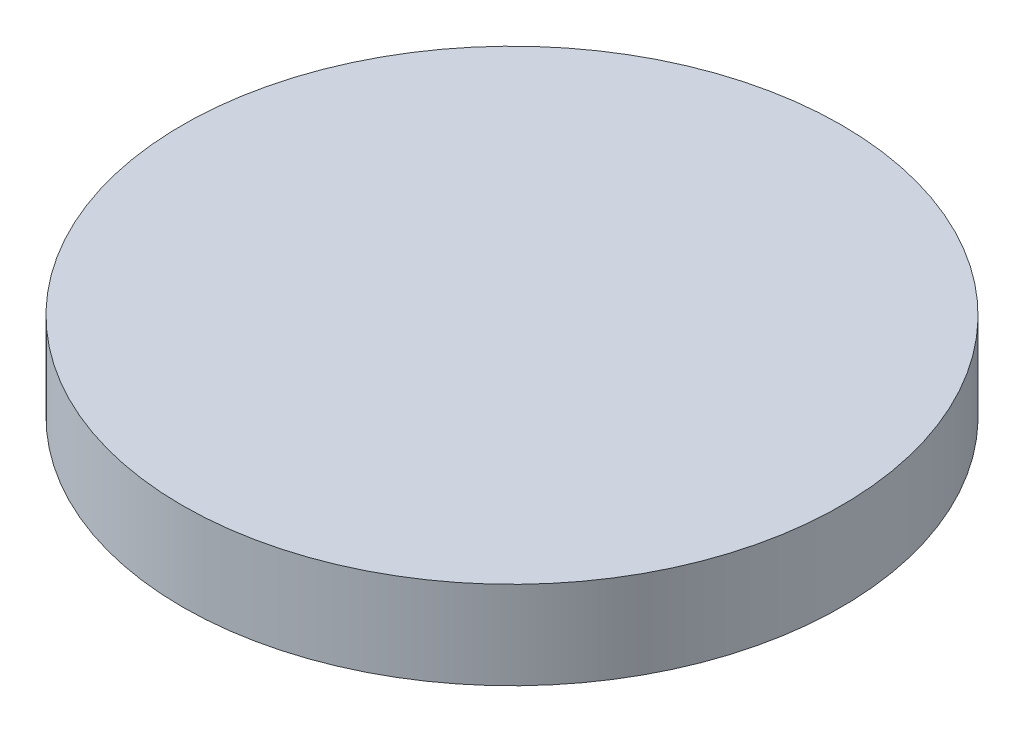
from build123d import *

# Parameters (mm, degrees)
SKETCH1_R           = 7.5
BOSS_EXTRUDE1_DEPTH = 2


with BuildPart() as part:
    # Sketch1 → Boss-Extrude1 (new body)
    with BuildSketch(Plane(origin=(0, 0, 0), x_dir=(1, 0, 0), z_dir=(0, 1, 0))):
        Circle(SKETCH1_R)
    extrude(amount=BOSS_EXTRUDE1_DEPTH)


solid = part.part
